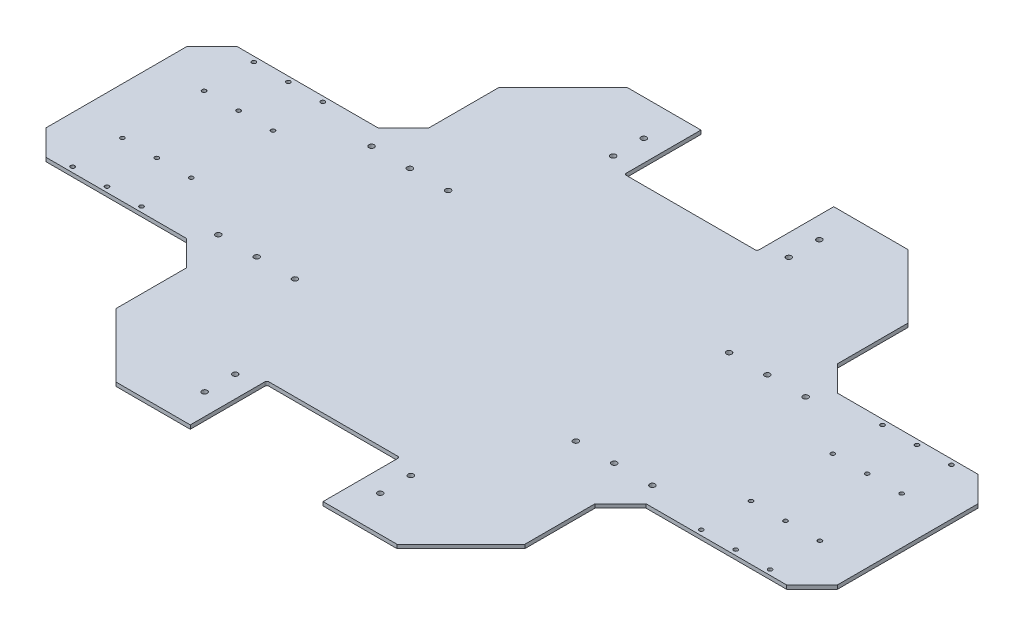
from build123d import *

# Parameters (mm, degrees)
EXTRUDE_1_DEPTH     = 3
CHAMFER_1_SIZE      = 20
CHAMFER_2_SIZE      = 50
SKETCH_2_W          = 104
SKETCH_2_H          = 93.088788678
CUT_EXTRUDE_1_DEPTH = 40
FILLET_1_R          = 1.5
SKETCH_3_R          = 2.1
CUT_EXTRUDE_2_DEPTH = 80
SKETCH_4_R          = 1.6
SKETCH_4_R_2        = 2.1
CUT_EXTRUDE_3_DEPTH = 29


with BuildPart() as part:
    # 草图1 → 凸台-拉伸1 (new body)
    with BuildSketch(Plane(origin=(0, 0, 0), x_dir=(1, 0, 0), z_dir=(0, 1, 0))):
        Polygon((-310, -75), (-160, -75), (-160, -200), (160, -200), (160, -75), (310, -75), (310, 75), (160, 75), (160, 200), (-160, 200), (-160, 75), (-310, 75), align=None)
    extrude(amount=EXTRUDE_1_DEPTH)

    # 倒角1
    chamfer_1_edges = [part.edges().sort_by_distance(p)[0] for p in [
        (-160, 1.5, -75),
        (-310, 1.5, -75),
        (-310, 1.5, 75),
        (-160, 1.5, 75),
        (160, 1.5, 75),
        (160, 1.5, -75),
        (310, 1.5, 75),
        (310, 1.5, -75),
    ]]
    chamfer(chamfer_1_edges, length=CHAMFER_1_SIZE)

    # 倒角2
    chamfer_2_edges = [part.edges().sort_by_distance(p)[0] for p in [
        (160, 1.5, 200),
        (-160, 1.5, 200),
        (160, 1.5, -200),
        (-160, 1.5, -200),
    ]]
    chamfer(chamfer_2_edges, length=CHAMFER_2_SIZE)

    # 草图2 → 切除-拉伸1 (cut)
    with BuildSketch(Plane(origin=(0, 0, 0), x_dir=(-1, 0, 0), z_dir=(0, -1, 0))):
        with Locations((0, -186.544394339)):
            Rectangle(SKETCH_2_W, SKETCH_2_H)
        with Locations((0, 186.544394339)):
            Rectangle(SKETCH_2_W, SKETCH_2_H)
    extrude(amount=-CUT_EXTRUDE_1_DEPTH, mode=Mode.SUBTRACT)

    # 圆角1
    fillet_1_edges = [part.edges().sort_by_distance(p)[0] for p in [
        (-52, 1.5, -140),
        (52, 1.5, -140),
        (52, 1.5, 140),
        (-52, 1.5, 140),
    ]]
    fillet(fillet_1_edges, radius=FILLET_1_R)

    # 草图3 → 切除-拉伸2 (cut)
    with BuildSketch(Plane.XZ):
        with Locations((-68.75, 172)):
            Circle(SKETCH_3_R)
        with Locations((-68.75, 148)):
            Circle(SKETCH_3_R)
        with Locations((68.75, 172)):
            Circle(SKETCH_3_R)
        with Locations((68.75, 148)):
            Circle(SKETCH_3_R)
        with Locations((-68.75, -148)):
            Circle(SKETCH_3_R)
        with Locations((-68.75, -172)):
            Circle(SKETCH_3_R)
        with Locations((68.75, -148)):
            Circle(SKETCH_3_R)
        with Locations((68.75, -172)):
            Circle(SKETCH_3_R)
    extrude(amount=-CUT_EXTRUDE_2_DEPTH, mode=Mode.SUBTRACT)

    # 草图4 → 切除-拉伸3 (cut)
    with BuildSketch(Plane.XZ):
        with Locations((273.200177837, 71)):
            Circle(SKETCH_4_R)
        with Locations((273.200177837, 31.998400192)):
            Circle(SKETCH_4_R)
        with Locations((246.200177837, 71)):
            Circle(SKETCH_4_R)
        with Locations((219.200177837, 71)):
            Circle(SKETCH_4_R)
        with Locations((246.200177837, 31.998400192)):
            Circle(SKETCH_4_R)
        with Locations((219.200177837, 31.998400192)):
            Circle(SKETCH_4_R)
        with Locations((110, 60)):
            Circle(SKETCH_4_R_2)
        with Locations((140, 60)):
            Circle(SKETCH_4_R_2)
        with Locations((170, 60)):
            Circle(SKETCH_4_R_2)
        with Locations((170, -60)):
            Circle(SKETCH_4_R_2)
        with Locations((140, -60)):
            Circle(SKETCH_4_R_2)
        with Locations((110, -60)):
            Circle(SKETCH_4_R_2)
        with Locations((219.200177837, -31.998400192)):
            Circle(SKETCH_4_R)
        with Locations((246.200177837, -31.998400192)):
            Circle(SKETCH_4_R)
        with Locations((219.200177837, -71)):
            Circle(SKETCH_4_R)
        with Locations((246.200177837, -71)):
            Circle(SKETCH_4_R)
        with Locations((273.200177837, -31.998400192)):
            Circle(SKETCH_4_R)
        with Locations((273.200177837, -71)):
            Circle(SKETCH_4_R)
        with Locations((-273.200177837, -71)):
            Circle(SKETCH_4_R)
        with Locations((-273.200177837, -31.998400192)):
            Circle(SKETCH_4_R)
        with Locations((-246.200177837, -71)):
            Circle(SKETCH_4_R)
        with Locations((-219.200177837, -71)):
            Circle(SKETCH_4_R)
        with Locations((-246.200177837, -31.998400192)):
            Circle(SKETCH_4_R)
        with Locations((-219.200177837, -31.998400192)):
            Circle(SKETCH_4_R)
        with Locations((-110, -60)):
            Circle(SKETCH_4_R_2)
        with Locations((-140, -60)):
            Circle(SKETCH_4_R_2)
        with Locations((-170, -60)):
            Circle(SKETCH_4_R_2)
        with Locations((-170, 60)):
            Circle(SKETCH_4_R_2)
        with Locations((-140, 60)):
            Circle(SKETCH_4_R_2)
        with Locations((-110, 60)):
            Circle(SKETCH_4_R_2)
        with Locations((-219.200177837, 31.998400192)):
            Circle(SKETCH_4_R)
        with Locations((-246.200177837, 31.998400192)):
            Circle(SKETCH_4_R)
        with Locations((-219.200177837, 71)):
            Circle(SKETCH_4_R)
        with Locations((-246.200177837, 71)):
            Circle(SKETCH_4_R)
        with Locations((-273.200177837, 31.998400192)):
            Circle(SKETCH_4_R)
        with Locations((-273.200177837, 71)):
            Circle(SKETCH_4_R)
    extrude(amount=-CUT_EXTRUDE_3_DEPTH, mode=Mode.SUBTRACT)


solid = part.part
